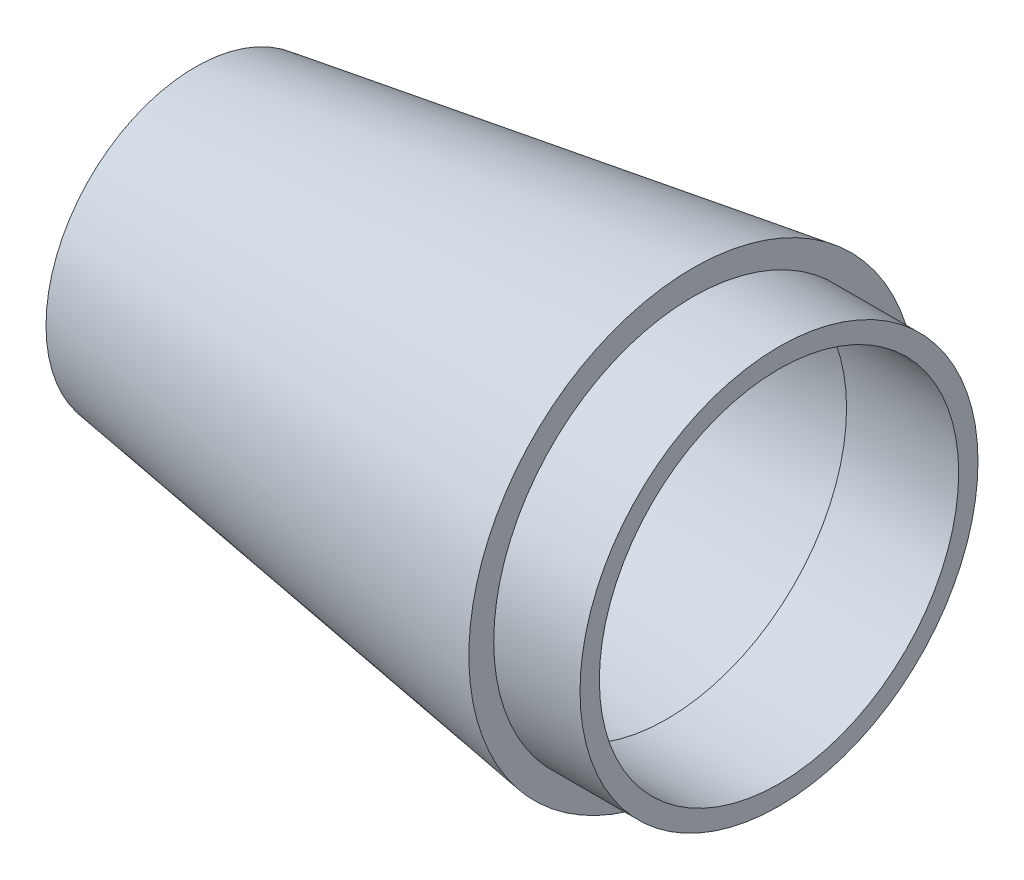
from build123d import *


with BuildPart() as part:
    # Sketch1 → Revolve4 (revolve)
    with BuildSketch(Plane.XY):
        Polygon((-12.065, 7.62), (-12.065, 6.35), (-0.941338875, 8.018549169), (-0.941338875, 0), (0.635, 0), (0.635, 8.255), (12.016776913, 9.962266537), (12.016776913, 9.173514897), (17.741353258, 9.173514897), (17.741353258, 10.16), (13.335, 10.16), (13.335, 11.43), align=None)
    revolve(axis=Axis((44.726440805, 0, 0), (-1, 0, 0)))


solid = part.part
